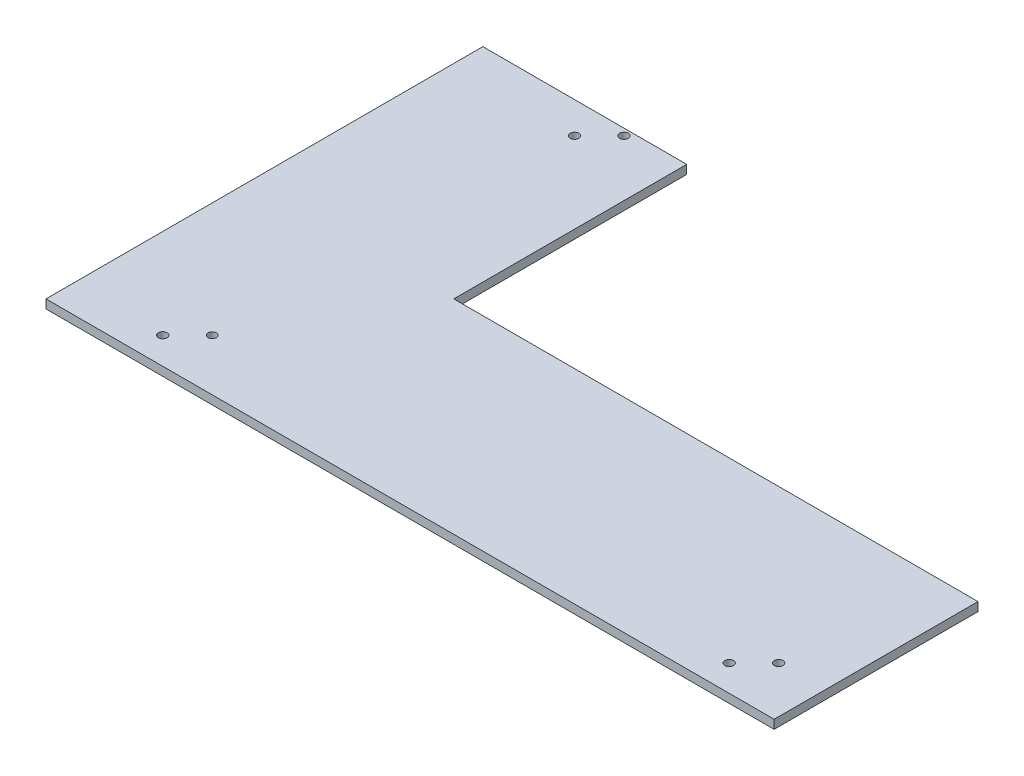
from build123d import *

# Parameters (mm, degrees)
SKETCH1_R           = 1.5
SKETCH1_R_2         = 1.44463942
BOSS_EXTRUDE1_DEPTH = 3


with BuildPart() as part:
    # Sketch1 → Boss-Extrude1 (new body)
    with BuildSketch(Plane(origin=(0, 0, 0), x_dir=(1, 0, 0), z_dir=(0, 1, 0))):
        Polygon((-125, -35), (125, -35), (125, 35), (-55, 35), (-55, 115), (-125, 115), (-125, 35), align=None)
        with Locations((-94.133157769, -25.756518953)):
            Circle(SKETCH1_R, mode=Mode.SUBTRACT)
        with Locations((-85.647876395, -17.271237578)):
            Circle(SKETCH1_R_2, mode=Mode.SUBTRACT)
        with Locations((100.573185828, -25.992159095)):
            Circle(SKETCH1_R, mode=Mode.SUBTRACT)
        with Locations((109.058467202, -17.506877721)):
            Circle(SKETCH1_R, mode=Mode.SUBTRACT)
        with Locations((-82.760714531, 104.243481047)):
            Circle(SKETCH1_R, mode=Mode.SUBTRACT)
        with Locations((-74.275433157, 112.728762422)):
            Circle(SKETCH1_R, mode=Mode.SUBTRACT)
    extrude(amount=BOSS_EXTRUDE1_DEPTH)


solid = part.part
